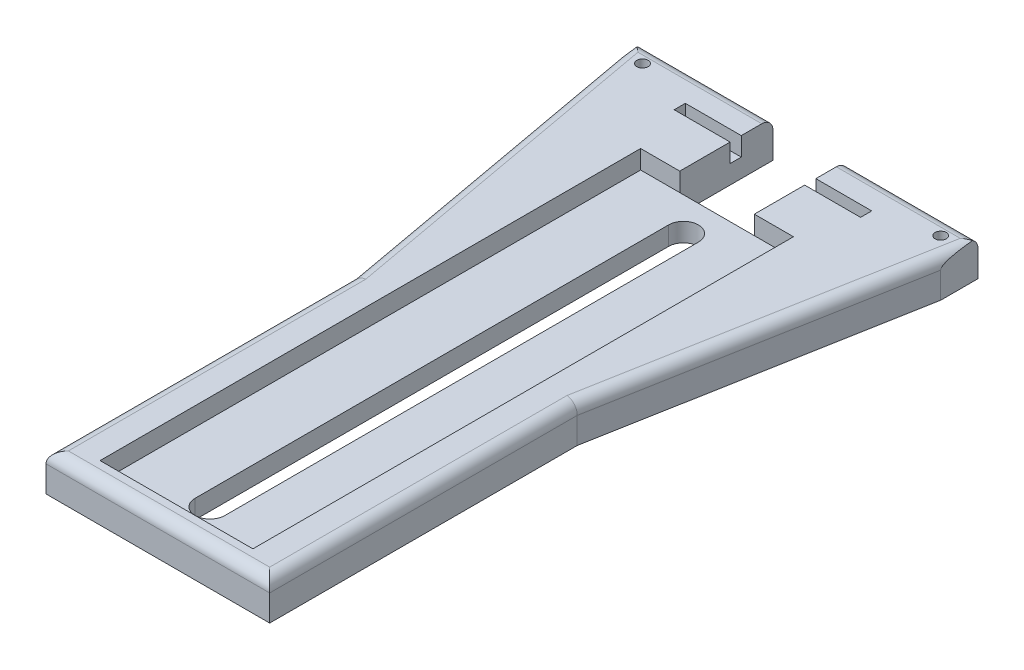
from build123d import *

# Parameters (mm, degrees)
SKETCH1_R           = 1.5
BOSS_EXTRUDE1_DEPTH = 10
SKETCH2_W           = 20.5
SKETCH2_H           = 145
CUT_EXTRUDE1_DEPTH  = 5
SKETCH3_W           = 20
SKETCH3_H           = 25
CUT_EXTRUDE2_DEPTH  = 181.969610709
SKETCH4_W           = 50
SKETCH4_H           = 3
CUT_EXTRUDE3_DEPTH  = 5
FILLET1_R           = 3
SKETCH6_R           = 1.5
CUT_EXTRUDE4_DEPTH  = 5
CHAMFER2_SIZE       = 1


with BuildPart() as part:
    # Sketch1 → Boss-Extrude1 (new body)
    with BuildSketch(Plane(origin=(0, 0, 0), x_dir=(1, 0, 0), z_dir=(0, 1, 0))):
        with BuildLine():
            Line((0, -30), (0, 0))
            Line((0, 0), (-45, 0))
            Line((-45, 0), (-45, -10))
            Line((-45, -10), (-30, -92.5))
            Line((-30, -92.5), (-30, -175))
            Line((-30, -175), (0, -175))
            Line((0, -175), (0, -165))
            ThreePointArc((0, -165), (-2.828427125, -163.828427125), (-4, -161))
            Line((-4, -161), (-4, -34))
            ThreePointArc((-4, -34), (-2.828427125, -31.171572875), (0, -30))
        make_face()
        with Locations(Location((-40, -5, 0), (0, 0, 270))):
            Circle(SKETCH1_R, mode=Mode.SUBTRACT)
    boss_extrude1 = extrude(amount=BOSS_EXTRUDE1_DEPTH)

    # Sketch2 → Cut-Extrude1 (cut)
    with BuildSketch(Plane(origin=(0, 10, 0), x_dir=(1, 0, 0), z_dir=(0, 1, 0))):
        with Locations((-10.25, -97.5)):
            Rectangle(SKETCH2_W, SKETCH2_H)
    cut_extrude1 = extrude(amount=-CUT_EXTRUDE1_DEPTH, mode=Mode.SUBTRACT)

    # Mirror1: Boss-Extrude1, Cut-Extrude1 across plane
    add(boss_extrude1.mirror(Plane(origin=(0, 0, 0), x_dir=(0, 0, 1), z_dir=(1, 0, 0))))
    add(cut_extrude1.mirror(Plane(origin=(0, 0, 0), x_dir=(0, 0, 1), z_dir=(1, 0, 0))), mode=Mode.SUBTRACT)

    # Sketch3 → Cut-Extrude2 (cut, through all)
    with BuildSketch(Plane(origin=(0, 10, 0), x_dir=(1, 0, 0), z_dir=(0, 1, 0))):
        with Locations((0, -12.5)):
            Rectangle(SKETCH3_W, SKETCH3_H)
    extrude(amount=-CUT_EXTRUDE2_DEPTH, mode=Mode.SUBTRACT)

    # Sketch4 → Cut-Extrude3 (cut)
    with BuildSketch(Plane(origin=(0, 10, 0), x_dir=(1, 0, 0), z_dir=(0, 1, 0))):
        with Locations((0, -10)):
            Rectangle(SKETCH4_W, SKETCH4_H)
    extrude(amount=-CUT_EXTRUDE3_DEPTH, mode=Mode.SUBTRACT)

    # Fillet1
    # the kernel refuses this fillet: 3 mm, written as the material it takes off along each edge
    with BuildSketch(Plane(origin=(-63, 10, 0), x_dir=(0, -1, 0), z_dir=(1, 0, 0)), Plane(origin=(-8, 10, 0), x_dir=(0, -1, 0), z_dir=(1, 0, 0))) as fillet1_piece_1:
        with BuildLine():
            CenterArc((FILLET1_R, -FILLET1_R), FILLET1_R, 90, 90)
            Line((0, -FILLET1_R), (-FILLET1_R * 0.02, -FILLET1_R))
            Line((-FILLET1_R * 0.02, -FILLET1_R), (-FILLET1_R * 0.02, FILLET1_R * 0.02))
            Line((-FILLET1_R * 0.02, FILLET1_R * 0.02), (FILLET1_R, FILLET1_R * 0.02))
            Line((FILLET1_R, FILLET1_R * 0.02), (FILLET1_R, 0))
        make_face()
    extrude(amount=71, mode=Mode.SUBTRACT)
    with BuildSketch(Plane(origin=(-48.219937888, 10, -7.709658382), x_dir=(0, -1, 0), z_dir=(0.1788854381999831, 0, 0.9838699100999075))) as fillet1_piece_2_section:
        with BuildLine():
            CenterArc((FILLET1_R, FILLET1_R), FILLET1_R, 180, 90)
            Line((0, FILLET1_R), (-FILLET1_R * 0.02, FILLET1_R))
            Line((-FILLET1_R * 0.02, FILLET1_R), (-FILLET1_R * 0.02, -FILLET1_R * 0.02))
            Line((-FILLET1_R * 0.02, -FILLET1_R * 0.02), (FILLET1_R, -FILLET1_R * 0.02))
            Line((FILLET1_R, -FILLET1_R * 0.02), (FILLET1_R, 0))
        make_face()
    fillet1_piece_2 = extrude(amount=119.852549156, mode=Mode.PRIVATE)
    fillet1_piece_2 = split(fillet1_piece_2, bisect_by=Plane(origin=(-30, 9.306962758, 40.50367668), z_dir=(-1, 0, 0)), keep=Keep.TOP, mode=Mode.PRIVATE)
    add(fillet1_piece_2, mode=Mode.SUBTRACT)
    with BuildSketch(Plane(origin=(-30, 10, 74.5), x_dir=(0, -1, 0), z_dir=(0, 0, 1))) as fillet1_piece_3_section:
        with BuildLine():
            CenterArc((FILLET1_R, FILLET1_R), FILLET1_R, 180, 90)
            Line((0, FILLET1_R), (-FILLET1_R * 0.02, FILLET1_R))
            Line((-FILLET1_R * 0.02, FILLET1_R), (-FILLET1_R * 0.02, -FILLET1_R * 0.02))
            Line((-FILLET1_R * 0.02, -FILLET1_R * 0.02), (FILLET1_R, -FILLET1_R * 0.02))
            Line((FILLET1_R, -FILLET1_R * 0.02), (FILLET1_R, 0))
        make_face()
    fillet1_piece_3 = extrude(amount=118.5, mode=Mode.PRIVATE)
    fillet1_piece_3 = split(fillet1_piece_3, bisect_by=Plane(origin=(-20.817808359, 9.30676914, 143.002054026), z_dir=(-0.9838699100999075, 0, 0.1788854381999831)), keep=Keep.TOP, mode=Mode.PRIVATE)
    add(fillet1_piece_3, mode=Mode.SUBTRACT)
    with BuildSketch(Plane(origin=(48, 10, 175), x_dir=(0, -1, 0), z_dir=(-1, 0, 0))) as fillet1_piece_4:
        with BuildLine():
            CenterArc((FILLET1_R, -FILLET1_R), FILLET1_R, 90, 90)
            Line((0, -FILLET1_R), (-FILLET1_R * 0.02, -FILLET1_R))
            Line((-FILLET1_R * 0.02, -FILLET1_R), (-FILLET1_R * 0.02, FILLET1_R * 0.02))
            Line((-FILLET1_R * 0.02, FILLET1_R * 0.02), (FILLET1_R, FILLET1_R * 0.02))
            Line((FILLET1_R, FILLET1_R * 0.02), (FILLET1_R, 0))
        make_face()
    extrude(amount=96, mode=Mode.SUBTRACT)
    with BuildSketch(Plane(origin=(30, 10, 74.5), x_dir=(0, -1, 0), z_dir=(0, 0, 1))) as fillet1_piece_5_section:
        with BuildLine():
            CenterArc((FILLET1_R, -FILLET1_R), FILLET1_R, 90, 90)
            Line((0, -FILLET1_R), (-FILLET1_R * 0.02, -FILLET1_R))
            Line((-FILLET1_R * 0.02, -FILLET1_R), (-FILLET1_R * 0.02, FILLET1_R * 0.02))
            Line((-FILLET1_R * 0.02, FILLET1_R * 0.02), (FILLET1_R, FILLET1_R * 0.02))
            Line((FILLET1_R, FILLET1_R * 0.02), (FILLET1_R, 0))
        make_face()
    fillet1_piece_5 = extrude(amount=118.5, mode=Mode.PRIVATE)
    fillet1_piece_5 = split(fillet1_piece_5, bisect_by=Plane(origin=(20.817808359, 9.30676914, 143.002054026), z_dir=(0.9838699100999075, 0, 0.1788854381999831)), keep=Keep.TOP, mode=Mode.PRIVATE)
    add(fillet1_piece_5, mode=Mode.SUBTRACT)
    with BuildSketch(Plane(origin=(48.219937888, 10, -7.709658382), x_dir=(0, -1, 0), z_dir=(-0.1788854381999831, 0, 0.9838699100999075))) as fillet1_piece_6_section:
        with BuildLine():
            CenterArc((FILLET1_R, -FILLET1_R), FILLET1_R, 90, 90)
            Line((0, -FILLET1_R), (-FILLET1_R * 0.02, -FILLET1_R))
            Line((-FILLET1_R * 0.02, -FILLET1_R), (-FILLET1_R * 0.02, FILLET1_R * 0.02))
            Line((-FILLET1_R * 0.02, FILLET1_R * 0.02), (FILLET1_R, FILLET1_R * 0.02))
            Line((FILLET1_R, FILLET1_R * 0.02), (FILLET1_R, 0))
        make_face()
    fillet1_piece_6 = extrude(amount=119.852549156, mode=Mode.PRIVATE)
    fillet1_piece_6 = split(fillet1_piece_6, bisect_by=Plane(origin=(30, 9.306962758, 40.50367668), z_dir=(1, 0, 0)), keep=Keep.TOP, mode=Mode.PRIVATE)
    add(fillet1_piece_6, mode=Mode.SUBTRACT)
    with BuildSketch(Plane(origin=(-30, 10, 74.5), x_dir=(0, -1, 0), z_dir=(0, 0, 1))) as fillet1_piece_7a_section:
        with BuildLine():
            CenterArc((FILLET1_R, FILLET1_R), FILLET1_R, 180, 90)
            Line((0, FILLET1_R), (-FILLET1_R * 0.02, FILLET1_R))
            Line((-FILLET1_R * 0.02, FILLET1_R), (-FILLET1_R * 0.02, -FILLET1_R * 0.02))
            Line((-FILLET1_R * 0.02, -FILLET1_R * 0.02), (FILLET1_R, -FILLET1_R * 0.02))
            Line((FILLET1_R, -FILLET1_R * 0.02), (FILLET1_R, 0))
        make_face()
    fillet1_piece_7a = extrude(amount=118.5, mode=Mode.PRIVATE)
    fillet1_piece_7a = split(fillet1_piece_7a, bisect_by=Plane(origin=(-31.178924404, 9.383343973, 86.015915779), z_dir=(0.9838699100999075, 0, -0.1788854381999831)), keep=Keep.TOP, mode=Mode.PRIVATE)
    with BuildSketch(Plane(origin=(-48.219937888, 10, -7.709658382), x_dir=(0, -1, 0), z_dir=(0.1788854381999831, 0, 0.9838699100999075))) as fillet1_piece_7b_section:
        with BuildLine():
            CenterArc((FILLET1_R, FILLET1_R), FILLET1_R, 180, 90)
            Line((0, FILLET1_R), (-FILLET1_R * 0.02, FILLET1_R))
            Line((-FILLET1_R * 0.02, FILLET1_R), (-FILLET1_R * 0.02, -FILLET1_R * 0.02))
            Line((-FILLET1_R * 0.02, -FILLET1_R * 0.02), (FILLET1_R, -FILLET1_R * 0.02))
            Line((FILLET1_R, -FILLET1_R * 0.02), (FILLET1_R, 0))
        make_face()
    fillet1_piece_7b = extrude(amount=119.852549156, mode=Mode.PRIVATE)
    fillet1_piece_7b = split(fillet1_piece_7b, bisect_by=Plane(origin=(-30, 9.383343973, 99.090387768), z_dir=(1, 0, 0)), keep=Keep.TOP, mode=Mode.PRIVATE)
    fillet1_piece_7 = fillet1_piece_7a & fillet1_piece_7b
    add(fillet1_piece_7, mode=Mode.SUBTRACT)
    with BuildSketch(Plane(origin=(48.219937888, 10, -7.709658382), x_dir=(0, -1, 0), z_dir=(-0.1788854381999831, 0, 0.9838699100999075))) as fillet1_piece_8a_section:
        with BuildLine():
            CenterArc((FILLET1_R, -FILLET1_R), FILLET1_R, 90, 90)
            Line((0, -FILLET1_R), (-FILLET1_R * 0.02, -FILLET1_R))
            Line((-FILLET1_R * 0.02, -FILLET1_R), (-FILLET1_R * 0.02, FILLET1_R * 0.02))
            Line((-FILLET1_R * 0.02, FILLET1_R * 0.02), (FILLET1_R, FILLET1_R * 0.02))
            Line((FILLET1_R, FILLET1_R * 0.02), (FILLET1_R, 0))
        make_face()
    fillet1_piece_8a = extrude(amount=119.852549156, mode=Mode.PRIVATE)
    fillet1_piece_8a = split(fillet1_piece_8a, bisect_by=Plane(origin=(30, 9.383343973, 99.090387768), z_dir=(-1, 0, 0)), keep=Keep.TOP, mode=Mode.PRIVATE)
    with BuildSketch(Plane(origin=(30, 10, 74.5), x_dir=(0, -1, 0), z_dir=(0, 0, 1))) as fillet1_piece_8b_section:
        with BuildLine():
            CenterArc((FILLET1_R, -FILLET1_R), FILLET1_R, 90, 90)
            Line((0, -FILLET1_R), (-FILLET1_R * 0.02, -FILLET1_R))
            Line((-FILLET1_R * 0.02, -FILLET1_R), (-FILLET1_R * 0.02, FILLET1_R * 0.02))
            Line((-FILLET1_R * 0.02, FILLET1_R * 0.02), (FILLET1_R, FILLET1_R * 0.02))
            Line((FILLET1_R, FILLET1_R * 0.02), (FILLET1_R, 0))
        make_face()
    fillet1_piece_8b = extrude(amount=118.5, mode=Mode.PRIVATE)
    fillet1_piece_8b = split(fillet1_piece_8b, bisect_by=Plane(origin=(31.178924404, 9.383343973, 86.015915779), z_dir=(-0.9838699100999075, 0, -0.1788854381999831)), keep=Keep.TOP, mode=Mode.PRIVATE)
    fillet1_piece_8 = fillet1_piece_8a & fillet1_piece_8b
    add(fillet1_piece_8, mode=Mode.SUBTRACT)

    # Sketch6 → Cut-Extrude4 (cut)
    # profile 1 of 2: a face of its own
    with BuildSketch(Plane.XZ):
        Polygon((-42.230176428, 2.993432508), (-39.377349792, 2.065326812), (-37.147173364, 4.071894304), (-37.769823572, 7.006567492), (-40.622650208, 7.934673188), (-42.852826636, 5.928105696), align=None)
        with Locations(Location((-40, 5, 0), (0, 0, 270))):
            Circle(SKETCH6_R, mode=Mode.SUBTRACT)
    # profile 2 of 2: a face of its own
    with BuildSketch(Plane.XZ):
        Polygon((37.056735483, 4.419315936), (39.031254892, 2.160716126), (41.974519409, 2.74140019), (42.943264517, 5.580684064), (40.968745108, 7.839283874), (38.025480591, 7.25859981), align=None)
        with Locations(Location((40, 5, 0), (0, 0, 270))):
            Circle(SKETCH6_R, mode=Mode.SUBTRACT)
    extrude(amount=-CUT_EXTRUDE4_DEPTH, mode=Mode.SUBTRACT)

    # Chamfer2
    chamfer2_edges = [part.edges().sort_by_distance(p)[0] for p in [
        (-40.80376311, 5, 2.52937966),
        (-42.541501532, 5, 4.460769102),
        (-41.737738422, 5, 6.931389442),
        (-39.19623689, 5, 7.47062034),
        (-37.458498468, 5, 5.539230898),
        (-38.262261578, 5, 3.068610558),
        (38.043995187, 5, 3.290016031),
        (37.541108037, 5, 5.838957873),
        (39.497112849, 5, 7.548941842),
        (41.956004813, 5, 6.709983969),
        (42.458891963, 5, 4.161042127),
        (40.502887151, 5, 2.451058158),
    ]]
    chamfer(chamfer2_edges, length=CHAMFER2_SIZE)


solid = part.part
